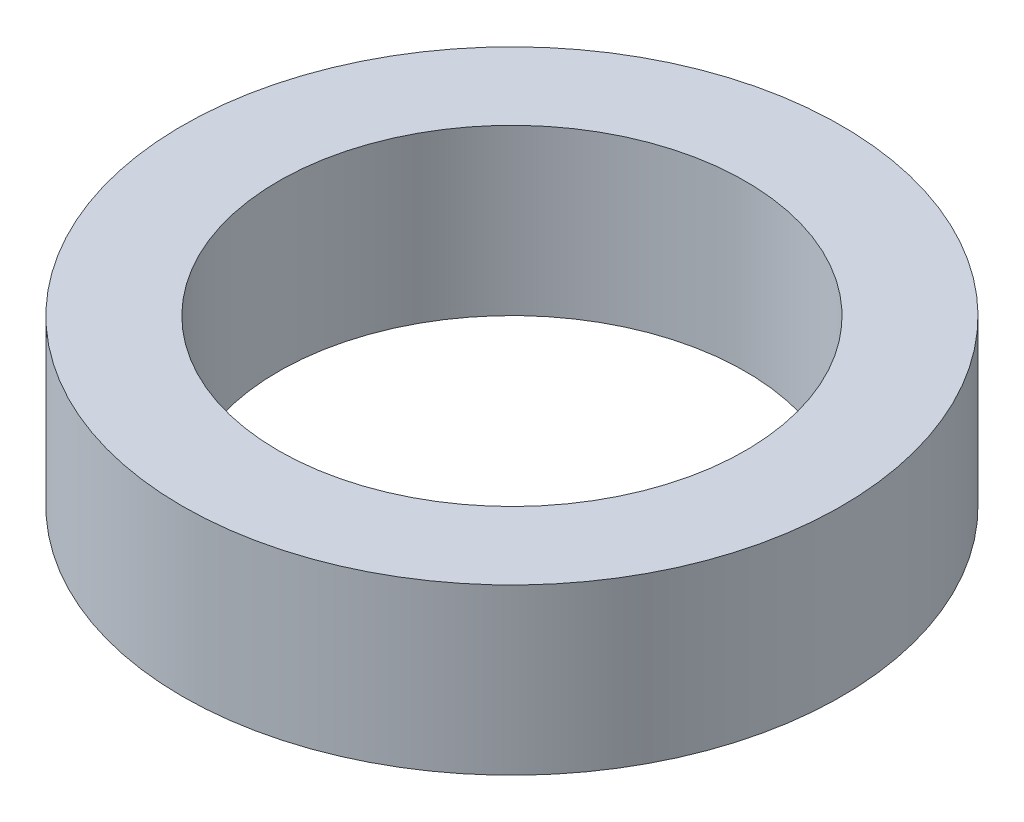
from build123d import *

# Parameters (mm, degrees)
SKETCH1_R           = 60
BOSS_EXTRUDE1_DEPTH = 30
SKETCH2_R           = 42.5
CUT_EXTRUDE1_DEPTH  = 91


with BuildPart() as part:
    # Sketch1 → Boss-Extrude1 (new body)
    with BuildSketch(Plane(origin=(0, 0, 0), x_dir=(1, 0, 0), z_dir=(0, 1, 0))):
        Circle(SKETCH1_R)
    extrude(amount=BOSS_EXTRUDE1_DEPTH)

    # Sketch2 → Cut-Extrude1 (cut, through all)
    with BuildSketch(Plane(origin=(0, 0, 0), x_dir=(1, 0, 0), z_dir=(0, 1, 0))):
        Circle(SKETCH2_R)
    extrude(amount=CUT_EXTRUDE1_DEPTH, mode=Mode.SUBTRACT)


solid = part.part
